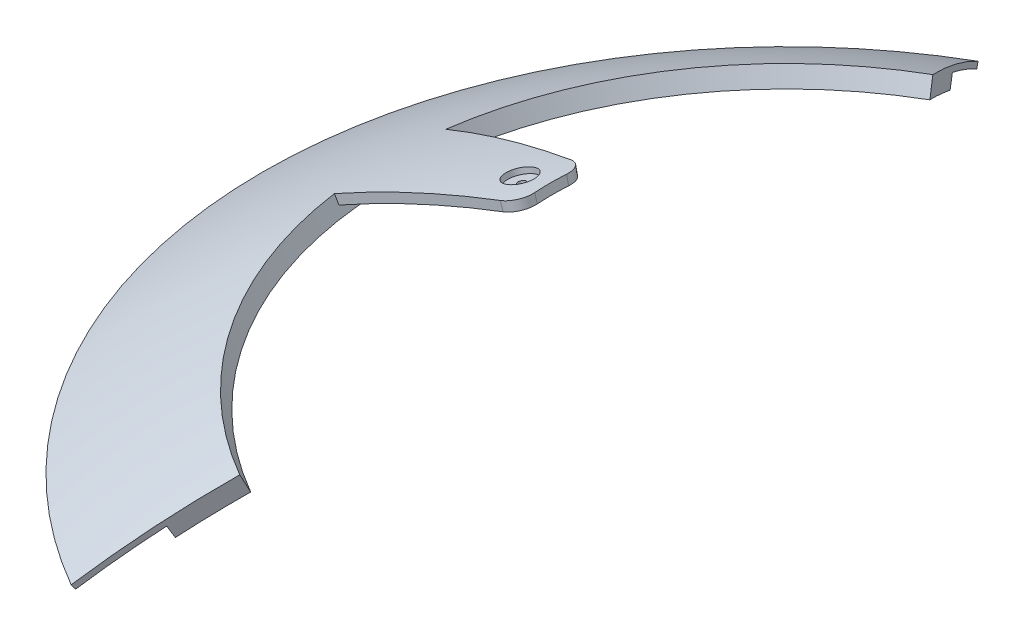
from build123d import *
from build123d.topology import SkipClean

# Parameters (mm, degrees)
REVOLVE2_ANGLE           = 60
REVOLVE2_OTHER_WAY_ANGLE = 60
REVOLVE3_ANGLE           = 8
REVOLVE3_OTHER_WAY_ANGLE = 8
FILLET1_R                = 5
CUT_REVOLVE1_START       = -250
CUT_REVOLVE1_OUTLINE_R   = 4
CUT_REVOLVE1_DEPTH       = 1.5
CUT_REVOLVE1_START_2     = -248.5
CUT_REVOLVE1_2_OUTLINE_R = 1
CUT_REVOLVE1_2_DEPTH     = 1.00202031
REVOLVE4_ANGLE           = 7.5
REVOLVE4_OTHER_WAY_ANGLE = 7.5


# Read off the part's stored shape, not the designer's step: Cut-Revolve1
with BuildPart() as part:
    # Sketch1 → Revolve2 (revolve)
    with BuildSketch(Plane.XY):
        with BuildLine():
            Line((-124.25, 215.20731284), (-122.5, 212.176223927))
            ThreePointArc((-122.5, 212.176223927), (-115.020532883, 216.32216025), (-107.400930963, 220.204541343))
            Line((-107.400930963, 220.204541343), (-109.592786697, 224.698511575))
            ThreePointArc((-109.592786697, 224.698511575), (-126.88459074, 215.40729011), (-143.394109088, 204.788011072))
            Line((-143.394109088, 204.788011072), (-142.533744433, 203.559283006))
            ThreePointArc((-142.533744433, 203.559283006), (-133.518952674, 209.582774284), (-124.25, 215.20731284))
        make_face()
    revolve(axis=Axis((0, 0, 0), (0, 1, 0)), revolution_arc=REVOLVE2_ANGLE)

    # Sketch1 → Revolve2 other way (revolve)
    with BuildSketch(Plane.XY):
        with BuildLine():
            Line((-124.25, 215.20731284), (-122.5, 212.176223927))
            ThreePointArc((-122.5, 212.176223927), (-115.020532883, 216.32216025), (-107.400930963, 220.204541343))
            Line((-107.400930963, 220.204541343), (-109.592786697, 224.698511575))
            ThreePointArc((-109.592786697, 224.698511575), (-126.88459074, 215.40729011), (-143.394109088, 204.788011072))
            Line((-143.394109088, 204.788011072), (-142.533744433, 203.559283006))
            ThreePointArc((-142.533744433, 203.559283006), (-133.518952674, 209.582774284), (-124.25, 215.20731284))
        make_face()
    revolve(axis=Axis((0, 0, 0), (0, -1, 0)), revolution_arc=REVOLVE2_OTHER_WAY_ANGLE)

    # Sketch2 → Revolve3 (revolve)
    with BuildSketch(Plane.XY):
        with BuildLine():
            ThreePointArc((-108.49685883, 222.451526459), (-86.676326862, 231.826366839), (-64.057713663, 239.066642007))
            Line((-64.057713663, 239.066642007), (-64.704761276, 241.481456572))
            ThreePointArc((-64.704761276, 241.481456572), (-87.551845315, 234.168047312), (-109.592786697, 224.698511575))
            Line((-109.592786697, 224.698511575), (-108.49685883, 222.451526459))
        make_face()
    revolve(axis=Axis((0, 0, 0), (0, 1, 0)), revolution_arc=REVOLVE3_ANGLE)

    # Sketch2 → Revolve3 other way (revolve)
    with BuildSketch(Plane.XY):
        with BuildLine():
            ThreePointArc((-108.49685883, 222.451526459), (-86.676326862, 231.826366839), (-64.057713663, 239.066642007))
            Line((-64.057713663, 239.066642007), (-64.704761276, 241.481456572))
            ThreePointArc((-64.704761276, 241.481456572), (-87.551845315, 234.168047312), (-109.592786697, 224.698511575))
            Line((-109.592786697, 224.698511575), (-108.49685883, 222.451526459))
        make_face()
    revolve(axis=Axis((0, 0, 0), (0, -1, 0)), revolution_arc=REVOLVE3_OTHER_WAY_ANGLE)

    # Fillet1
    fillet1_edges = [part.edges().sort_by_distance(p)[0] for p in [
        (-63.754683692, 240.274049289, -8.960136462),
        (-63.754683692, 240.274049289, 8.960136462),
    ]]
    fillet(fillet1_edges, radius=FILLET1_R)

    # Cut-Revolve1 outline → Cut-Revolve1 (cut)
    with SkipClean():  # the faces are left unmerged after this step: merging them gives an invalid solid
        with BuildSketch(Plane(origin=(0, 0, 0), x_dir=(0.9564822051761176, 0.29179066328693826, 0), z_dir=(0.2917906632869382, -0.9564822051761177, 0)).offset(CUT_REVOLVE1_START)):
            Circle(CUT_REVOLVE1_OUTLINE_R)
        extrude(amount=CUT_REVOLVE1_DEPTH, mode=Mode.SUBTRACT)

    # Cut-Revolve1 2 outline → Cut-Revolve1 2 (cut)
    with SkipClean():  # the faces are left unmerged after this step: merging them gives an invalid solid
        with BuildSketch(Plane(origin=(0, 0, 0), x_dir=(0.9564822051761176, 0.29179066328693826, 0), z_dir=(0.2917906632869382, -0.9564822051761177, 0)).offset(CUT_REVOLVE1_START_2)):
            Circle(CUT_REVOLVE1_2_OUTLINE_R)
        extrude(amount=CUT_REVOLVE1_2_DEPTH, mode=Mode.SUBTRACT)

    # Sketch4 → Revolve4 (revolve)
    with SkipClean():  # the faces are left unmerged after this step: merging them gives an invalid solid
        with BuildSketch(Plane.XY):
            with BuildLine():
                Line((-135.306423797, 208.433254735), (-134.48968482, 207.175106316))
                ThreePointArc((-134.48968482, 207.175106316), (-133.602565478, 207.748296017), (-132.713003262, 208.317687116))
                Line((-132.713003262, 208.317687116), (-133.518952674, 209.582774285))
                ThreePointArc((-133.518952674, 209.582774285), (-134.41391709, 209.009925345), (-135.306423797, 208.433254735))
            make_face()
            with BuildLine():
                Line((-134.48968482, 207.175106316), (-133.400699518, 205.497575091))
                ThreePointArc((-133.400699518, 205.497575091), (-132.520763328, 206.066123579), (-131.638404045, 206.630904224))
                Line((-131.638404045, 206.630904224), (-132.713003262, 208.317687116))
                ThreePointArc((-132.713003262, 208.317687116), (-133.602565478, 207.748296017), (-134.48968482, 207.175106316))
            make_face()
            with BuildLine():
                Line((-132.713003262, 208.317687116), (-131.638404045, 206.630904224))
                ThreePointArc((-131.638404045, 206.630904224), (-129.830219737, 207.771783558), (-128.012148355, 208.896840267))
                Line((-128.012148355, 208.896840267), (-129.057145485, 210.602120595))
                ThreePointArc((-129.057145485, 210.602120595), (-130.890058266, 209.467879751), (-132.713003262, 208.317687116))
            make_face()
        revolve(axis=Axis((0, 0, 0), (0, 1, 0)), revolution_arc=REVOLVE4_ANGLE)

    # Sketch4 → Revolve4 other way (revolve)
    with SkipClean():  # the faces are left unmerged after this step: merging them gives an invalid solid
        with BuildSketch(Plane.XY):
            with BuildLine():
                Line((-135.306423797, 208.433254735), (-134.48968482, 207.175106316))
                ThreePointArc((-134.48968482, 207.175106316), (-133.602565478, 207.748296017), (-132.713003262, 208.317687116))
                Line((-132.713003262, 208.317687116), (-133.518952674, 209.582774285))
                ThreePointArc((-133.518952674, 209.582774285), (-134.41391709, 209.009925345), (-135.306423797, 208.433254735))
            make_face()
            with BuildLine():
                Line((-134.48968482, 207.175106316), (-133.400699518, 205.497575091))
                ThreePointArc((-133.400699518, 205.497575091), (-132.520763328, 206.066123579), (-131.638404045, 206.630904224))
                Line((-131.638404045, 206.630904224), (-132.713003262, 208.317687116))
                ThreePointArc((-132.713003262, 208.317687116), (-133.602565478, 207.748296017), (-134.48968482, 207.175106316))
            make_face()
            with BuildLine():
                Line((-132.713003262, 208.317687116), (-131.638404045, 206.630904224))
                ThreePointArc((-131.638404045, 206.630904224), (-129.830219737, 207.771783558), (-128.012148355, 208.896840267))
                Line((-128.012148355, 208.896840267), (-129.057145485, 210.602120595))
                ThreePointArc((-129.057145485, 210.602120595), (-130.890058266, 209.467879751), (-132.713003262, 208.317687116))
            make_face()
        revolve(axis=Axis((0, 0, 0), (0, -1, 0)), revolution_arc=REVOLVE4_OTHER_WAY_ANGLE)


solid = part.part
